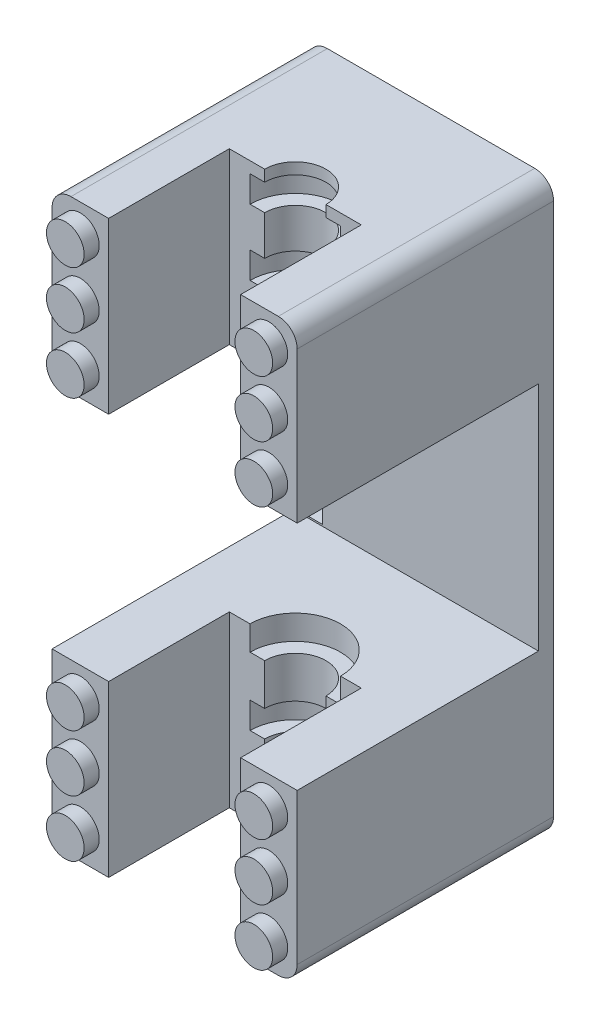
from build123d import *

# Parameters (mm, degrees)
SKETCH1_W                 = 32.5
SKETCH1_H                 = 22.5
BOSS_EXTRUDE1_DEPTH       = 16
SKETCH2_W                 = 32.5
SKETCH2_H                 = 37.845937441
BOSS_EXTRUDE2_DEPTH       = 2
CUT_EXTRUDE2_DEPTH        = 59.458857784
SKETCH3_R                 = 6
SKETCH3_R_2               = 4.0625
CUT_EXTRUDE1_DEPTH        = 3.5
LPATTERN1_COUNT           = 3
LPATTERN1_PITCH           = 8.75
MIRROR7_COPY_1_SKETCH_R   = 6
MIRROR7_COPY_1_SKETCH_R_2 = 4.0625
MIRROR7_COPY_1_DEPTH      = 3.5
MIRROR7_COPY_2_SKETCH_R   = 6
MIRROR7_COPY_2_SKETCH_R_2 = 4.0625
MIRROR7_COPY_2_DEPTH      = 3.5
MIRROR7_COPY_3_SKETCH_R   = 6
MIRROR7_COPY_3_SKETCH_R_2 = 4.0625
MIRROR7_COPY_3_DEPTH      = 3.5
SKETCH5_W                 = 7.5
SKETCH5_H                 = 22.5
BOSS_EXTRUDE6_DEPTH       = 16
SKETCH6_R                 = 2.5
BOSS_EXTRUDE7_DEPTH       = 2
SKETCH7_W                 = 3.25
SKETCH7_H                 = 8.25
CUT_EXTRUDE3_DEPTH        = 10
LPATTERN2_COUNT           = 2
LPATTERN2_PITCH           = 7.5
LPATTERN3_COUNT           = 2
LPATTERN3_PITCH           = 7.5
BOSS_EXTRUDE8_START       = -18.845937441
BOSS_EXTRUDE8_DEPTH       = 0.25
BOSS_EXTRUDE9_START       = 18.595937441
BOSS_EXTRUDE9_DEPTH       = 0.25
FILLET1_R                 = 2.5
SKETCH10_W                = 0.625
SKETCH10_H                = 8.470937441
CUT_EXTRUDE4_DEPTH        = 54.407653766


# Read off the part's stored shape, not the designer's step: Boss-Extrude8, Boss-Extrude9
with BuildPart() as part:
    # Sketch1 → Boss-Extrude1 (new body)
    with BuildSketch(Plane.XY):
        with Locations((0, -26.595937441)):
            Rectangle(SKETCH1_W, SKETCH1_H)
    boss_extrude1 = extrude(amount=-BOSS_EXTRUDE1_DEPTH)

    # Sketch2 → Boss-Extrude2 (add)
    with BuildSketch(Plane(origin=(0, 0, -16), x_dir=(-1, 0, 0), z_dir=(0, 0, -1))):
        with Locations((0, -18.922968721)):
            Rectangle(SKETCH2_W, SKETCH2_H)
    boss_extrude2 = extrude(amount=BOSS_EXTRUDE2_DEPTH)

    # Mirror4: Boss-Extrude2 across plane
    add(boss_extrude2.mirror(Plane(origin=(-16.25, 0, -18), x_dir=(0, 0, 1), z_dir=(0, -1, 0))))

    # Mirror5: Boss-Extrude1 across plane
    add(boss_extrude1.mirror(Plane.ZX))

    # Sketch3<3> → Cut-Extrude2 (cut, through all)
    with BuildSketch(Plane(origin=(0, -15.345937441, 0), x_dir=(1, 0, 0), z_dir=(0, 1, 0))):
        with BuildLine():
            Line((-4.0625, 0), (4.0625, 0))
            ThreePointArc((4.0625, 0), (0, 4.0625), (-4.0625, 0))
        make_face()
        with BuildLine():
            ThreePointArc((-4.0625, 0), (0, -4.0625), (4.0625, 0))
            Line((4.0625, 0), (-4.0625, 0))
        make_face()
    cut_extrude2 = extrude(amount=-CUT_EXTRUDE2_DEPTH, mode=Mode.SUBTRACT)

    # Sketch3 → Cut-Extrude1 (cut)
    with BuildSketch(Plane(origin=(0, -15.345937441, 0), x_dir=(1, 0, 0), z_dir=(0, 1, 0))):
        Circle(SKETCH3_R)
        Circle(SKETCH3_R_2, mode=Mode.SUBTRACT)
    cut_extrude1 = extrude(amount=-CUT_EXTRUDE1_DEPTH, mode=Mode.SUBTRACT)

    # LPattern1: Cut-Extrude1 ×3
    with Locations(*[(0, -i * LPATTERN1_PITCH, 0) for i in range(1, LPATTERN1_COUNT)]):
        add(cut_extrude1, mode=Mode.SUBTRACT)

    # Mirror6: Cut-Extrude2, Cut-Extrude1 across plane
    add(cut_extrude2.mirror(Plane.ZX), mode=Mode.SUBTRACT)
    add(cut_extrude1.mirror(Plane.ZX), mode=Mode.SUBTRACT)

    # Mirror6 at the second plane: Cut-Extrude2, Cut-Extrude1 across plane
    add(cut_extrude2.mirror(Plane.XY), mode=Mode.SUBTRACT)
    add(cut_extrude1.mirror(Plane.XY), mode=Mode.SUBTRACT)

    # Mirror7 copy 1 sketch → Mirror7 copy 1 (cut)
    with BuildSketch(Plane.XZ.offset(-24.095937441)):
        Circle(MIRROR7_COPY_1_SKETCH_R)
        Circle(MIRROR7_COPY_1_SKETCH_R_2, mode=Mode.SUBTRACT)
    extrude(amount=-MIRROR7_COPY_1_DEPTH, mode=Mode.SUBTRACT)

    # Mirror7 copy 2 sketch → Mirror7 copy 2 (cut)
    with BuildSketch(Plane.XZ.offset(-32.845937441)):
        Circle(MIRROR7_COPY_2_SKETCH_R)
        Circle(MIRROR7_COPY_2_SKETCH_R_2, mode=Mode.SUBTRACT)
    extrude(amount=-MIRROR7_COPY_2_DEPTH, mode=Mode.SUBTRACT)

    # Mirror7 copy 3 sketch → Mirror7 copy 3 (cut)
    with BuildSketch(Plane.XZ.offset(-15.345937441)):
        Circle(MIRROR7_COPY_3_SKETCH_R)
        Circle(MIRROR7_COPY_3_SKETCH_R_2, mode=Mode.SUBTRACT)
    extrude(amount=-MIRROR7_COPY_3_DEPTH, mode=Mode.SUBTRACT)

    # Sketch5 → Boss-Extrude6 (add)
    with BuildSketch(Plane.XY):
        with Locations((-12.5, -26.595937441)):
            Rectangle(SKETCH5_W, SKETCH5_H)
        with Locations((12.5, -26.595937441)):
            Rectangle(SKETCH5_W, SKETCH5_H)
        with Locations((12.5, 26.595937441)):
            Rectangle(SKETCH5_W, SKETCH5_H)
        with Locations((-12.5, 26.595937441)):
            Rectangle(SKETCH5_W, SKETCH5_H)
    extrude(amount=BOSS_EXTRUDE6_DEPTH)

    # Sketch6 → Boss-Extrude7 (add)
    with BuildSketch(Plane.XY.offset(16)):
        with Locations(Location((-12.5, -26.595937441, 0), (0, 0, 180))):
            Circle(SKETCH6_R)
        with Locations(Location((-12.5, 26.595937441, 0), (0, 0, 180))):
            Circle(SKETCH6_R)
        with Locations((12.5, 26.595937441)):
            Circle(SKETCH6_R)
        with Locations(Location((12.5, -26.595937441, 0), (0, 0, 180))):
            Circle(SKETCH6_R)
    boss_extrude7 = extrude(amount=BOSS_EXTRUDE7_DEPTH)

    # Sketch7 → Cut-Extrude3 (cut)
    with BuildSketch(Plane(origin=(0, 0, -18), x_dir=(-1, 0, 0), z_dir=(0, 0, -1))):
        with Locations((14, -11)):
            Rectangle(SKETCH7_W, SKETCH7_H)
        with Locations((14, 11)):
            Rectangle(SKETCH7_W, SKETCH7_H)
    extrude(amount=-CUT_EXTRUDE3_DEPTH, mode=Mode.SUBTRACT)

    # LPattern2: Boss-Extrude7 ×2
    with Locations(*[(0, -i * LPATTERN2_PITCH, 0) for i in range(1, LPATTERN2_COUNT)]):
        add(boss_extrude7)

    # LPattern3: Boss-Extrude7 ×2
    with Locations(*[(0, i * LPATTERN3_PITCH, 0) for i in range(1, LPATTERN3_COUNT)]):
        add(boss_extrude7)

    # Boss-Extrude8 outline → Boss-Extrude8 (add)
    with BuildSketch(Plane(origin=(0, 0, 0), x_dir=(1, 0, 0), z_dir=(0, 1, 0)).offset(BOSS_EXTRUDE8_START)):
        with BuildLine():
            ThreePointArc((-4.0625, 0), (0, 4.0625), (4.0625, 0))
            Line((4.0625, 0), (6, 0))
            ThreePointArc((6, 0), (0, 6), (-6, 0))
            Line((-6, 0), (-4.0625, 0))
        make_face()
    extrude(amount=BOSS_EXTRUDE8_DEPTH)

    # Boss-Extrude9 outline → Boss-Extrude9 (add)
    with BuildSketch(Plane(origin=(0, 0, 0), x_dir=(1, 0, 0), z_dir=(0, 1, 0)).offset(BOSS_EXTRUDE9_START)):
        with BuildLine():
            ThreePointArc((6, 0), (0, 6), (-6, 0))
            Line((-6, 0), (-4.0625, 0))
            ThreePointArc((-4.0625, 0), (0, 4.0625), (4.0625, 0))
            Line((4.0625, 0), (6, 0))
        make_face()
    extrude(amount=BOSS_EXTRUDE9_DEPTH)

    # Fillet1
    fillet1_edges = [part.edges().sort_by_distance(p)[0] for p in [
        (-16.25, 37.845937441, -1),
        (16.25, 37.845937441, -1),
        (16.25, -37.845937441, -1),
        (-16.25, -37.845937441, -1),
    ]]
    fillet(fillet1_edges, radius=FILLET1_R)

    # Sketch10 → Cut-Extrude4 (cut, through all)
    with BuildSketch(Plane.XY.offset(-16)):
        with Locations((-15.9375, 11.110468721)):
            Rectangle(SKETCH10_W, SKETCH10_H)
        with Locations((-15.9375, -11.110468721)):
            Rectangle(SKETCH10_W, SKETCH10_H)
    extrude(amount=-CUT_EXTRUDE4_DEPTH, mode=Mode.SUBTRACT)


solid = part.part
